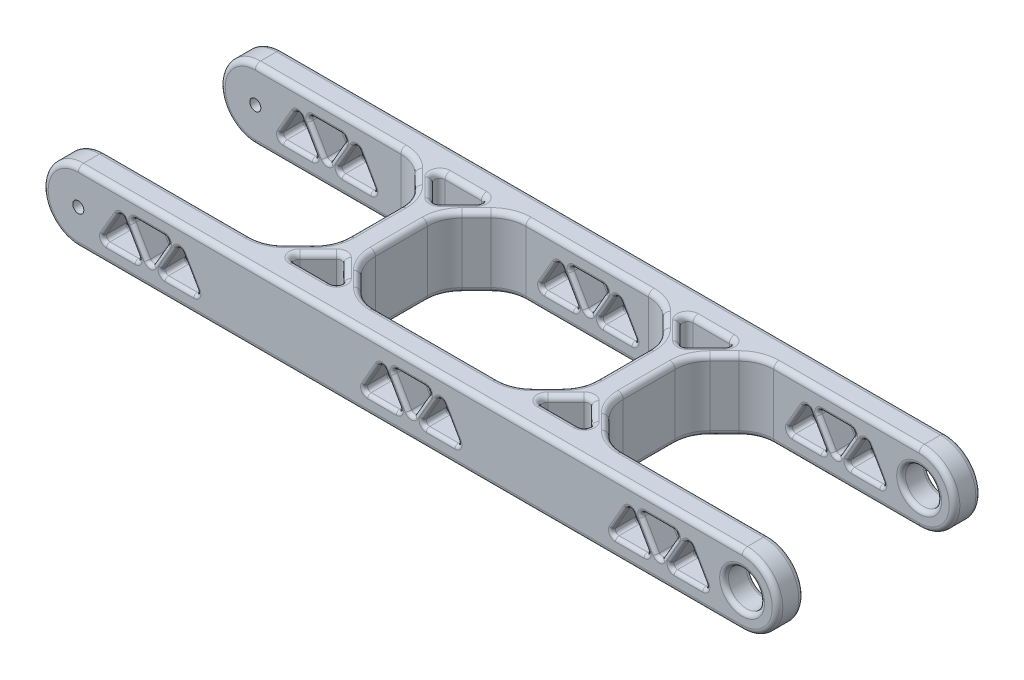
from build123d import *

# Parameters (mm, degrees)
SKETCH1_R               = 1.5875
SKETCH1_R_2             = 5.1816
BOSS_EXTRUDE1_DEPTH     = 7.62
SKETCH2_R               = 1.5875
SKETCH2_R_2             = 5.1816
BOSS_EXTRUDE3_DEPTH     = 7.62
SKETCH4_W               = 7.62
SKETCH4_H               = 43.18
BOSS_EXTRUDE4_DEPTH     = 20.32
CHAMFER2_SIZE           = 10
CHAMFER3_SIZE           = 10
CUT_EXTRUDE1_DEPTH      = 20.574
FILLET1_R               = 10
FILLET2_R               = 10
FILLET3_R               = 10
FILLET5_R               = 1.524
CUT_EXTRUDE2_DEPTH      = 94.234
CUT_EXTRUDE3_DEPTH      = 94.234
FILLET12_R              = 1.016
LPATTERN1_COUNT         = 2
LPATTERN1_PITCH         = 74.93
FILLET12_OF_LPATTERN1_R = 1.016
FILLET13_R              = 1.27
LPATTERN2_COUNT         = 2
LPATTERN2_PITCH         = 146.05
FILLET12_OF_LPATTERN2_R = 1.016


with BuildPart() as part:
    # Sketch1 → Boss-Extrude1 (new body)
    with BuildSketch(Plane.XY):
        with BuildLine():
            Line((190.5, 10.16), (0, 10.16))
            ThreePointArc((0, 10.16), (-10.16, 0), (0, -10.16))
            Line((0, -10.16), (190.5, -10.16))
            ThreePointArc((190.5, -10.16), (200.66, 0), (190.5, 10.16))
        make_face()
        Circle(SKETCH1_R, mode=Mode.SUBTRACT)
        with Locations((190.5, 0)):
            Circle(SKETCH1_R_2, mode=Mode.SUBTRACT)
    extrude(amount=BOSS_EXTRUDE1_DEPTH)



with BuildPart() as body_2:
    # Sketch2 → Boss-Extrude3 (new body)
    with BuildSketch(Plane.XY.offset(50.8)):
        with BuildLine():
            Line((190.5, 10.16), (0, 10.16))
            ThreePointArc((0, 10.16), (-10.16, 0), (0, -10.16))
            Line((0, -10.16), (190.5, -10.16))
            ThreePointArc((190.5, -10.16), (200.66, 0), (190.5, 10.16))
        make_face()
        Circle(SKETCH2_R, mode=Mode.SUBTRACT)
        with Locations((190.5, 0)):
            Circle(SKETCH2_R_2, mode=Mode.SUBTRACT)
    extrude(amount=BOSS_EXTRUDE3_DEPTH)


with BuildPart() as part_1:
    add(part.part)

    add(body_2.part)  # Boss-Extrude4 merges body 2
    # Sketch4 → Boss-Extrude4 (add)
    with BuildSketch(Plane(origin=(0, 10.16, 0), x_dir=(1, 0, 0), z_dir=(0, 1, 0))):
        with Locations((59.69, -29.21)):
            Rectangle(SKETCH4_W, SKETCH4_H)
        with Locations((130.81, -29.21)):
            Rectangle(SKETCH4_W, SKETCH4_H)
    extrude(amount=-BOSS_EXTRUDE4_DEPTH)

    # Chamfer2
    chamfer2_edges = [part_1.edges().sort_by_distance(p)[0] for p in [
        (134.62, 0, 50.8),
        (134.62, 0, 7.62),
    ]]
    chamfer(chamfer2_edges, length=CHAMFER2_SIZE)

    # Chamfer3
    chamfer3_edges = [part_1.edges().sort_by_distance(p)[0] for p in [
        (63.5, 0, 7.62),
        (63.5, 0, 50.8),
        (55.88, 0, 50.8),
        (55.88, 0, 7.62),
        (127, 0, 7.62),
        (127, 0, 50.8),
    ]]
    chamfer(chamfer3_edges, length=CHAMFER3_SIZE)

    # Sketch5 → Cut-Extrude1 (cut)
    with BuildSketch(Plane(origin=(0, 10.16, 0), x_dir=(1, 0, 0), z_dir=(0, 1, 0))):
        Polygon((50.8, -7.62), (59.69, -16.51), (68.58, -7.62), align=None)
        Polygon((59.69, -41.91), (68.58, -50.8), (50.8, -50.8), align=None)
        Polygon((130.81, -16.51), (121.92, -7.62), (139.7, -7.62), align=None)
        Polygon((139.7, -50.8), (130.81, -41.91), (121.92, -50.8), align=None)
    extrude(amount=-CUT_EXTRUDE1_DEPTH, mode=Mode.SUBTRACT)

    # Fillet1
    fillet1_edges = [part_1.edges().sort_by_distance(p)[0] for p in [
        (127, 0, 17.62),
    ]]
    fillet(fillet1_edges, radius=FILLET1_R)

    # Fillet2
    fillet2_edges = [part_1.edges().sort_by_distance(p)[0] for p in [
        (45.88, 0, 7.62),
        (55.88, 0, 17.62),
        (55.88, 0, 40.8),
        (45.88, 0, 50.8),
        (73.5, 0, 50.8),
        (63.5, 0, 40.8),
        (73.5, 0, 7.62),
        (63.5, 0, 17.62),
        (117, 0, 50.8),
        (144.62, 0, 50.8),
        (144.62, 0, 7.62),
        (134.62, 0, 40.8),
        (134.62, 0, 17.62),
        (127, 0, 40.8),
    ]]
    fillet(fillet2_edges, radius=FILLET2_R)

    # Fillet3
    fillet3_edges = [part_1.edges().sort_by_distance(p)[0] for p in [
        (117, 0, 7.62),
    ]]
    fillet(fillet3_edges, radius=FILLET3_R)

    # Fillet5
    fillet5_edges = [part_1.edges().sort_by_distance(p)[0] for p in [
        (200.66, 0, 50.8),
        (169.631067812, -10.16, 50.8),
        (144.9353013, -10.16, 50.038795325),
        (139.62, -10.16, 45.8),
        (135.381204675, -10.16, 40.4846987),
        (134.62, -10.16, 29.21),
        (135.381204675, -10.16, 17.9353013),
        (139.62, -10.16, 12.62),
        (144.9353013, -10.16, 8.381204675),
        (169.631067812, -10.16, 7.62),
        (200.66, 0, 7.62),
        (200.66, 0, 58.42),
        (95.25, -10.16, 58.42),
        (-10.16, 0, 58.42),
        (-10.16, 0, 50.8),
        (20.868932188, -10.16, 50.8),
        (45.5646987, -10.16, 50.038795325),
        (50.88, -10.16, 45.8),
        (55.118795325, -10.16, 40.4846987),
        (55.88, -10.16, 29.21),
        (55.118795325, -10.16, 17.9353013),
        (50.88, -10.16, 12.62),
        (45.5646987, -10.16, 8.381204675),
        (20.868932188, -10.16, 7.62),
        (-10.16, 0, 7.62),
        (200.66, 0, 0),
        (95.25, -10.16, 0),
        (-10.16, 0, 0),
        (169.631067812, 10.16, 7.62),
        (144.9353013, 10.16, 8.381204675),
        (139.62, 10.16, 12.62),
        (135.381204675, 10.16, 17.9353013),
        (134.62, 10.16, 29.21),
        (135.381204675, 10.16, 40.4846987),
        (139.62, 10.16, 45.8),
        (144.9353013, 10.16, 50.038795325),
        (169.631067812, 10.16, 50.8),
        (95.25, 10.16, 58.42),
        (20.868932188, 10.16, 50.8),
        (45.5646987, 10.16, 50.038795325),
        (50.88, 10.16, 45.8),
        (55.118795325, 10.16, 40.4846987),
        (55.88, 10.16, 29.21),
        (55.118795325, 10.16, 17.9353013),
        (50.88, 10.16, 12.62),
        (45.5646987, 10.16, 8.381204675),
        (20.868932188, 10.16, 7.62),
        (95.25, 10.16, 0),
        (73.8153013, 10.16, 8.381204675),
        (68.5, 10.16, 12.62),
        (64.261204675, 10.16, 17.9353013),
        (63.5, 10.16, 29.21),
        (64.261204675, 10.16, 40.4846987),
        (68.5, 10.16, 45.8),
        (73.8153013, 10.16, 50.038795325),
        (95.25, 10.16, 50.8),
        (116.6846987, 10.16, 50.038795325),
        (122, 10.16, 45.8),
        (126.238795325, 10.16, 40.4846987),
        (127, 10.16, 29.21),
        (126.238795325, 10.16, 17.9353013),
        (122, 10.16, 12.62),
        (116.6846987, 10.16, 8.381204675),
        (95.25, 10.16, 7.62),
        (64.135, 10.16, 12.065),
        (59.69, 10.16, 7.62),
        (55.245, 10.16, 12.065),
        (126.365, 10.16, 46.355),
        (130.81, 10.16, 50.8),
        (135.255, 10.16, 46.355),
        (126.365, 10.16, 12.065),
        (135.255, 10.16, 12.065),
        (130.81, 10.16, 7.62),
        (64.135, 10.16, 46.355),
        (55.245, 10.16, 46.355),
        (59.69, 10.16, 50.8),
        (121.92, 0, 7.62),
        (130.81, 0, 41.91),
        (59.69, 0, 41.91),
        (139.7, 0, 7.62),
        (130.81, 0, 16.51),
        (121.92, 0, 50.8),
        (50.8, 0, 50.8),
        (139.7, 0, 50.8),
        (68.58, 0, 50.8),
        (50.8, 0, 7.62),
        (59.69, 0, 16.51),
        (68.58, 0, 7.62),
        (55.245, -10.16, 12.065),
        (59.69, -10.16, 7.62),
        (59.69, -10.16, 50.8),
        (55.245, -10.16, 46.355),
        (130.81, -10.16, 7.62),
        (135.255, -10.16, 12.065),
        (126.365, -10.16, 46.355),
        (135.255, -10.16, 46.355),
        (73.8153013, -10.16, 50.038795325),
        (68.5, -10.16, 45.8),
        (64.261204675, -10.16, 40.4846987),
        (63.5, -10.16, 29.21),
        (64.261204675, -10.16, 17.9353013),
        (68.5, -10.16, 12.62),
        (73.8153013, -10.16, 8.381204675),
        (95.25, -10.16, 7.62),
        (116.6846987, -10.16, 8.381204675),
        (122, -10.16, 12.62),
        (126.238795325, -10.16, 17.9353013),
        (127, -10.16, 29.21),
        (126.238795325, -10.16, 40.4846987),
        (122, -10.16, 45.8),
        (116.6846987, -10.16, 50.038795325),
        (64.135, -10.16, 12.065),
        (64.135, -10.16, 46.355),
        (126.365, -10.16, 12.065),
        (95.25, -10.16, 50.8),
        (130.81, -10.16, 50.8),
    ]]
    fillet(fillet5_edges, radius=FILLET5_R)

    # Sketch6 → Cut-Extrude2 (cut)
    with BuildSketch(Plane.XY.offset(58.42)):
        Polygon((6.35, -5.08), (12.215878735, 5.08), (18.08175747, -5.08), align=None)
        Polygon((34.89351494, -5.08), (23.16175747, -5.08), (29.027636205, 5.08), align=None)
    cut_extrude2 = extrude(amount=-CUT_EXTRUDE2_DEPTH, mode=Mode.SUBTRACT)

    # Sketch7 → Cut-Extrude3 (cut)
    with BuildSketch(Plane.XY.offset(58.42)):
        Polygon((14.755878735, 5.08), (20.62175747, -5.08), (26.487636205, 5.08), align=None)
    cut_extrude3 = extrude(amount=-CUT_EXTRUDE3_DEPTH, mode=Mode.SUBTRACT)

    # Fillet12
    fillet12_edges = [part_1.edges().sort_by_distance(p)[0] for p in [
        (12.215878735, 5.08, 54.61),
        (18.08175747, -5.08, 54.61),
        (6.35, -5.08, 54.61),
        (14.755878735, 5.08, 54.61),
        (20.62175747, -5.08, 54.61),
        (26.487636205, 5.08, 54.61),
        (23.16175747, -5.08, 54.61),
        (34.89351494, -5.08, 54.61),
        (29.027636205, 5.08, 54.61),
        (12.215878735, -5.08, 7.62),
        (9.282939367, 0, 7.62),
        (17.688818102, 0, 7.62),
        (20.62175747, 5.08, 7.62),
        (31.960575572, 0, 7.62),
        (29.027636205, -5.08, 7.62),
        (31.960575572, 0, 0),
        (29.027636205, -5.08, 0),
        (20.62175747, 5.08, 0),
        (23.554696837, 0, 0),
        (15.148818102, 0, 0),
        (12.215878735, -5.08, 0),
        (12.215878735, -5.08, 50.8),
        (9.282939367, 0, 50.8),
        (17.688818102, 0, 50.8),
        (20.62175747, 5.08, 50.8),
        (29.027636205, -5.08, 50.8),
        (26.094696837, 0, 50.8),
        (12.215878735, -5.08, 58.42),
        (9.282939367, 0, 58.42),
        (17.688818102, 0, 58.42),
        (20.62175747, 5.08, 58.42),
        (31.960575572, 0, 58.42),
        (29.027636205, -5.08, 58.42),
        (15.148818102, 0, 7.62),
        (23.554696837, 0, 7.62),
        (26.094696837, 0, 7.62),
        (26.094696837, 0, 0),
        (17.688818102, 0, 0),
        (9.282939367, 0, 0),
        (6.35, -5.08, 3.81),
        (23.16175747, -5.08, 3.81),
        (34.89351494, -5.08, 3.81),
        (18.08175747, -5.08, 3.81),
        (14.755878735, 5.08, 3.81),
        (26.487636205, 5.08, 3.81),
        (29.027636205, 5.08, 3.81),
        (12.215878735, 5.08, 3.81),
        (20.62175747, -5.08, 3.81),
        (15.148818102, 0, 50.8),
        (23.554696837, 0, 50.8),
        (31.960575572, 0, 50.8),
        (15.148818102, 0, 58.42),
        (23.554696837, 0, 58.42),
        (26.094696837, 0, 58.42),
    ]]
    fillet(fillet12_edges, radius=FILLET12_R)

    # LPattern1: Cut-Extrude2, Cut-Extrude3 ×2
    with Locations(*[(i * LPATTERN1_PITCH, 0, 0) for i in range(1, LPATTERN1_COUNT)]):
        add(cut_extrude2, mode=Mode.SUBTRACT)
        add(cut_extrude3, mode=Mode.SUBTRACT)

    # Fillet12 of LPattern1
    fillet12_of_lpattern1_edges = [part_1.edges().sort_by_distance(p)[0] for p in [
        (87.145878735, 5.08, 54.61),
        (93.01175747, -5.08, 54.61),
        (81.28, -5.08, 54.61),
        (89.685878735, 5.08, 54.61),
        (95.55175747, -5.08, 54.61),
        (101.417636205, 5.08, 54.61),
        (98.09175747, -5.08, 54.61),
        (109.82351494, -5.08, 54.61),
        (103.957636205, 5.08, 54.61),
        (87.145878735, -5.08, 7.62),
        (84.212939367, 0, 7.62),
        (92.618818102, 0, 7.62),
        (95.55175747, 5.08, 7.62),
        (106.890575572, 0, 7.62),
        (103.957636205, -5.08, 7.62),
        (106.890575572, 0, 0),
        (103.957636205, -5.08, 0),
        (95.55175747, 5.08, 0),
        (98.484696837, 0, 0),
        (90.078818102, 0, 0),
        (87.145878735, -5.08, 0),
        (87.145878735, -5.08, 50.8),
        (84.212939367, 0, 50.8),
        (92.618818102, 0, 50.8),
        (95.55175747, 5.08, 50.8),
        (103.957636205, -5.08, 50.8),
        (101.024696837, 0, 50.8),
        (87.145878735, -5.08, 58.42),
        (84.212939367, 0, 58.42),
        (92.618818102, 0, 58.42),
        (95.55175747, 5.08, 58.42),
        (106.890575572, 0, 58.42),
        (103.957636205, -5.08, 58.42),
        (90.078818102, 0, 7.62),
        (98.484696837, 0, 7.62),
        (101.024696837, 0, 7.62),
        (101.024696837, 0, 0),
        (92.618818102, 0, 0),
        (84.212939367, 0, 0),
        (81.28, -5.08, 3.81),
        (98.09175747, -5.08, 3.81),
        (109.82351494, -5.08, 3.81),
        (93.01175747, -5.08, 3.81),
        (89.685878735, 5.08, 3.81),
        (101.417636205, 5.08, 3.81),
        (103.957636205, 5.08, 3.81),
        (87.145878735, 5.08, 3.81),
        (95.55175747, -5.08, 3.81),
        (90.078818102, 0, 50.8),
        (98.484696837, 0, 50.8),
        (106.890575572, 0, 50.8),
        (90.078818102, 0, 58.42),
        (98.484696837, 0, 58.42),
        (101.024696837, 0, 58.42),
    ]]
    fillet(fillet12_of_lpattern1_edges, radius=FILLET12_OF_LPATTERN1_R)

    # Fillet13
    fillet13_edges = [part_1.edges().sort_by_distance(p)[0] for p in [
        (185.3184, 0, 58.42),
        (185.3184, 0, 50.8),
        (185.3184, 0, 7.62),
        (185.3184, 0, 0),
    ]]
    fillet(fillet13_edges, radius=FILLET13_R)

    # LPattern2: Cut-Extrude2, Cut-Extrude3 ×2
    with Locations(*[(i * LPATTERN2_PITCH, 0, 0) for i in range(1, LPATTERN2_COUNT)]):
        add(cut_extrude2, mode=Mode.SUBTRACT)
        add(cut_extrude3, mode=Mode.SUBTRACT)

    # Fillet12 of LPattern2
    fillet12_of_lpattern2_edges = [part_1.edges().sort_by_distance(p)[0] for p in [
        (158.265878735, 5.08, 54.61),
        (164.13175747, -5.08, 54.61),
        (152.4, -5.08, 54.61),
        (160.805878735, 5.08, 54.61),
        (166.67175747, -5.08, 54.61),
        (172.537636205, 5.08, 54.61),
        (169.21175747, -5.08, 54.61),
        (180.94351494, -5.08, 54.61),
        (175.077636205, 5.08, 54.61),
        (158.265878735, -5.08, 7.62),
        (155.332939367, 0, 7.62),
        (163.738818102, 0, 7.62),
        (166.67175747, 5.08, 7.62),
        (178.010575572, 0, 7.62),
        (175.077636205, -5.08, 7.62),
        (178.010575572, 0, 0),
        (175.077636205, -5.08, 0),
        (166.67175747, 5.08, 0),
        (169.604696837, 0, 0),
        (161.198818102, 0, 0),
        (158.265878735, -5.08, 0),
        (158.265878735, -5.08, 50.8),
        (155.332939367, 0, 50.8),
        (163.738818102, 0, 50.8),
        (166.67175747, 5.08, 50.8),
        (175.077636205, -5.08, 50.8),
        (172.144696837, 0, 50.8),
        (158.265878735, -5.08, 58.42),
        (155.332939367, 0, 58.42),
        (163.738818102, 0, 58.42),
        (166.67175747, 5.08, 58.42),
        (178.010575572, 0, 58.42),
        (175.077636205, -5.08, 58.42),
        (161.198818102, 0, 7.62),
        (169.604696837, 0, 7.62),
        (172.144696837, 0, 7.62),
        (172.144696837, 0, 0),
        (163.738818102, 0, 0),
        (155.332939367, 0, 0),
        (152.4, -5.08, 3.81),
        (169.21175747, -5.08, 3.81),
        (180.94351494, -5.08, 3.81),
        (164.13175747, -5.08, 3.81),
        (160.805878735, 5.08, 3.81),
        (172.537636205, 5.08, 3.81),
        (175.077636205, 5.08, 3.81),
        (158.265878735, 5.08, 3.81),
        (166.67175747, -5.08, 3.81),
        (161.198818102, 0, 50.8),
        (169.604696837, 0, 50.8),
        (178.010575572, 0, 50.8),
        (161.198818102, 0, 58.42),
        (169.604696837, 0, 58.42),
        (172.144696837, 0, 58.42),
    ]]
    fillet(fillet12_of_lpattern2_edges, radius=FILLET12_OF_LPATTERN2_R)


solid = part_1.part
